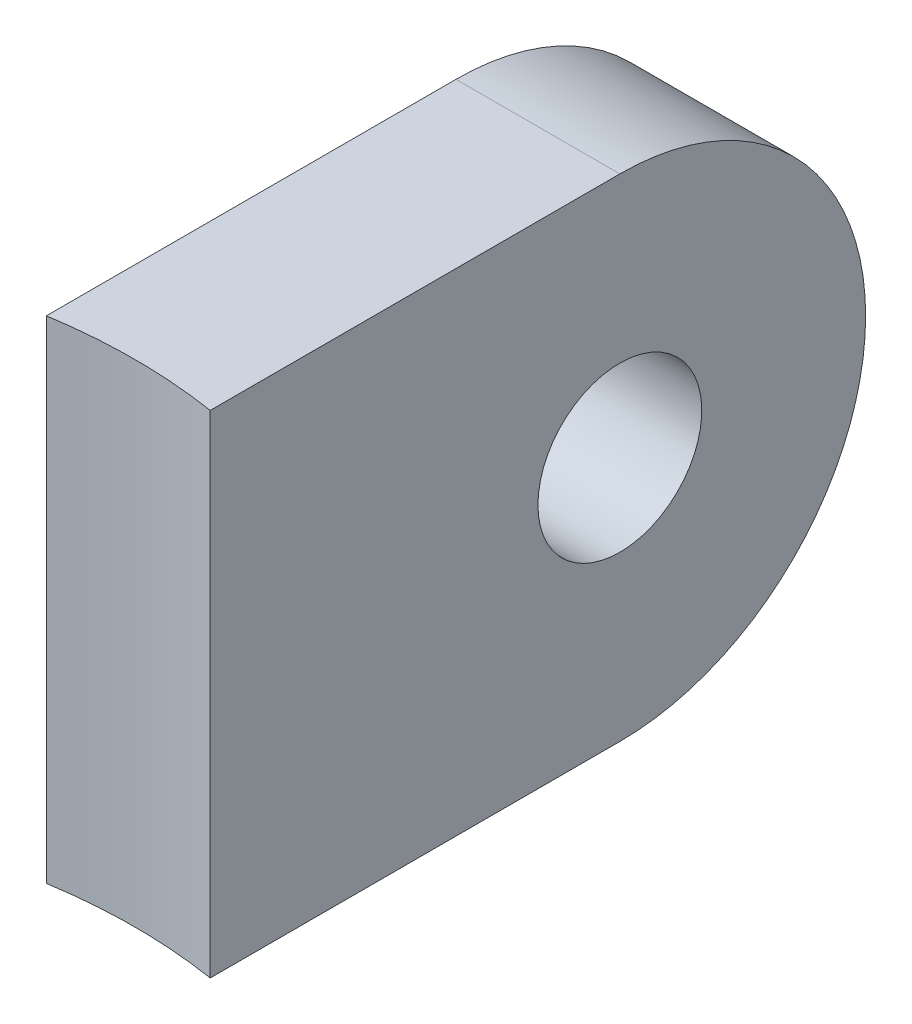
from build123d import *

# Parameters (mm, degrees)
BOSS_EXTRUDE1_DEPTH = 15
FILLET1_R           = 7.5
SKETCH2_R           = 2.5
CUT_EXTRUDE1_DEPTH  = 40.023610486


with BuildPart() as part:
    # Sketch1 → Boss-Extrude1 (new body)
    with BuildSketch(Plane(origin=(0, 0, 0), x_dir=(1, 0, 0), z_dir=(0, 1, 0))):
        with BuildLine():
            Line((-2.5, 15.676913759), (-2.5, 35.676913759))
            Line((-2.5, 35.676913759), (2.5, 35.676913759))
            Line((2.5, 35.676913759), (2.5, 15.676913759))
            ThreePointArc((2.5, 15.676913759), (0, 15.875), (-2.5, 15.676913759))
        make_face()
    extrude(amount=BOSS_EXTRUDE1_DEPTH)

    # Fillet1
    fillet1_edges = [part.edges().sort_by_distance(p)[0] for p in [
        (0, 0, -35.676913759),
        (0, 15, -35.676913759),
    ]]
    fillet(fillet1_edges, radius=FILLET1_R - 0.0001)  # a hair under: the kernel refuses the full size

    # Sketch2 → Cut-Extrude1 (cut, through all)
    with BuildSketch(Plane.ZY.offset(2.5)):
        with Locations((-28.176913759, 7.5)):
            Circle(SKETCH2_R)
    extrude(amount=-CUT_EXTRUDE1_DEPTH, mode=Mode.SUBTRACT)


solid = part.part
